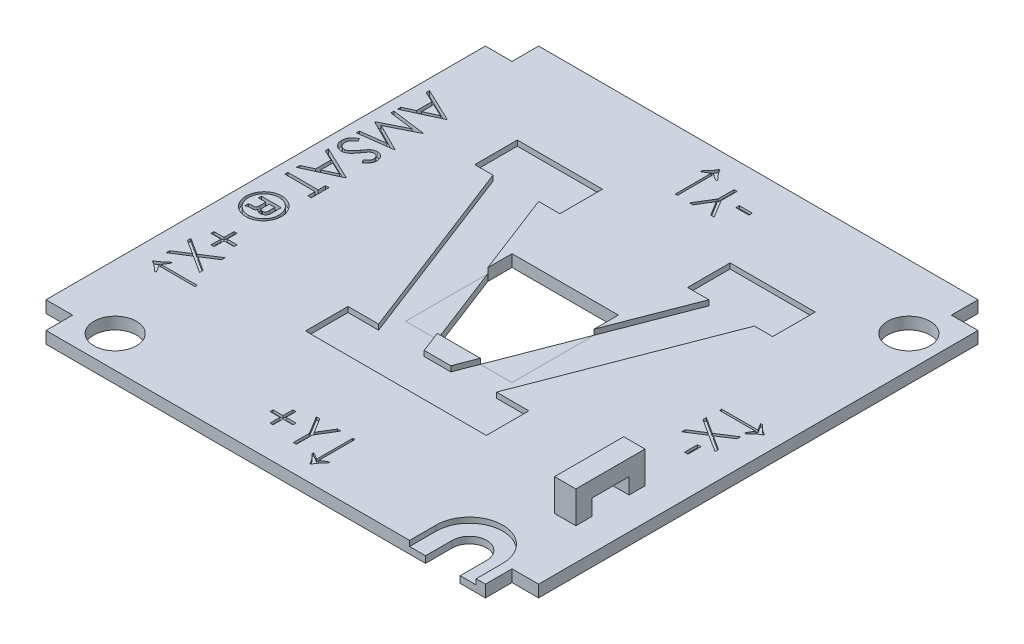
from build123d import *

# Parameters (mm, degrees)
BOSS_EXTRUDE1_DEPTH   = 2.25
SKETCH3_R             = 4
CUT_EXTRUDE1_DEPTH    = 10
CUT_EXTRUDE3_DEPTH    = 10
CUT_EXTRUDE4_DEPTH    = 1
SKETCH7_W             = 20
SKETCH7_H             = 20
CUT_EXTRUDE5_DEPTH    = 10
CUT_EXTRUDE9_DEPTH    = 1
CUT_EXTRUDE10_DEPTH   = 1
CUT_EXTRUDE7_DEPTH    = 1
BOSS_EXTRUDE3_DEPTH   = 2.25
BOSS_EXTRUDE3_2_DEPTH = 2.25
CUT_EXTRUDE8_DEPTH    = 1
SKETCH22_W            = 2.442307692
SKETCH22_H            = 0.651282051
SKETCH22_W_2          = 0.651282051
SKETCH22_H_2          = 2.442307693
CUT_EXTRUDE11_DEPTH   = 0.5
SKETCH23_W            = 4
SKETCH23_H            = 3
BOSS_EXTRUDE4_DEPTH   = 3
SKETCH24_W            = 4
SKETCH24_H            = 13
BOSS_EXTRUDE5_DEPTH   = 3


with BuildPart() as part:
    # Sketch2 → Boss-Extrude1 (new body)
    with BuildSketch(Plane(origin=(0, 0, 0), x_dir=(1, 0, 0), z_dir=(0, 1, 0))):
        Polygon((-41.3, 41.3), (-46.3, 41.3), (-46.3, -41.3), (-41.3, -41.3), (-41.3, -46.3), (41.3, -46.3), (41.3, -41.3), (46.3, -41.3), (46.3, 41.3), (41.3, 41.3), (41.3, 46.3), (-41.3, 46.3), align=None)
    extrude(amount=BOSS_EXTRUDE1_DEPTH)

    # Sketch3 → Cut-Extrude1 (cut)
    with BuildSketch(Plane(origin=(0, 2.25, 0), x_dir=(1, 0, 0), z_dir=(0, 1, 0))):
        with Locations((-34.3, -40.3)):
            Circle(SKETCH3_R)
        with Locations((40.3, 34.3)):
            Circle(SKETCH3_R)
    extrude(amount=-CUT_EXTRUDE1_DEPTH, mode=Mode.SUBTRACT)

    # Sketch5 → Cut-Extrude3 (cut)
    with BuildSketch(Plane(origin=(0, 2.25, 0), x_dir=(1, 0, 0), z_dir=(0, 1, 0))):
        with BuildLine():
            Line((30.05, -41.3), (30.05, -46.3))
            Line((30.05, -46.3), (36.55, -46.3))
            Line((36.55, -46.3), (36.55, -41.3))
            ThreePointArc((36.55, -41.3), (33.3, -38.05), (30.05, -41.3))
        make_face()
    extrude(amount=-CUT_EXTRUDE3_DEPTH, mode=Mode.SUBTRACT)

    # Sketch6 → Cut-Extrude4 (cut)
    with BuildSketch(Plane(origin=(0, 2.25, 0), x_dir=(1, 0, 0), z_dir=(0, 1, 0))):
        with BuildLine():
            Line((27.05, -46.3), (27.05, -41.3))
            ThreePointArc((27.05, -41.3), (33.3, -35.05), (39.55, -41.3))
            Line((39.55, -41.3), (39.55, -46.3))
            Line((39.55, -46.3), (36.55, -46.3))
            Line((36.55, -46.3), (36.55, -41.3))
            Line((36.55, -41.3), (30.05, -41.3))
            Line((30.05, -41.3), (30.05, -46.3))
            Line((30.05, -46.3), (27.05, -46.3))
        make_face()
    extrude(amount=-CUT_EXTRUDE4_DEPTH, mode=Mode.SUBTRACT)

    # Sketch7 → Cut-Extrude5 (cut)
    with BuildSketch(Plane(origin=(0, 2.25, 0), x_dir=(1, 0, 0), z_dir=(0, 1, 0))):
        Rectangle(SKETCH7_W, SKETCH7_H)
    extrude(amount=-CUT_EXTRUDE5_DEPTH, mode=Mode.SUBTRACT)

    # Sketch12 → Cut-Extrude9 (cut)
    # profile 1 of 5: a face of its own
    with BuildSketch(Plane(origin=(0, 2.25, 0), x_dir=(1, 0, 0), z_dir=(0, 1, 0))):
        Polygon((-37.95, 25.69277339), (-44.3, 22.762004159), (-44.3, 23.381485329), (-42.26474359, 24.320247348), (-42.26474359, 27.198863133), (-44.3, 28.164337893), (-44.3, 28.786363133), (-37.95, 25.774183646), align=None)
        Polygon((-39.187690304, 25.739838694), (-41.613461538, 26.889758566), (-41.613461538, 24.620447669), align=None, mode=Mode.SUBTRACT)
    # profile 2 of 5: a face of its own
    with BuildSketch(Plane(origin=(0, 2.25, 0), x_dir=(1, 0, 0), z_dir=(0, 1, 0))):
        Polygon((-44.3, 22.110722108), (-37.95, 21.272450874), (-37.95, 21.191040617), (-43.16025641, 18.569375954), (-37.95, 15.954071467), (-37.95, 15.871389175), (-44.3, 15.0280298), (-44.3, 15.600445666), (-39.730849359, 16.208478518), (-44.3, 18.50068605), (-44.3, 18.629161611), (-39.720673077, 20.93027339), (-44.3, 21.537034207), align=None)
    # profile 3 of 5: a face of its own
    with BuildSketch(Plane(origin=(0, 2.25, 0), x_dir=(1, 0, 0), z_dir=(0, 1, 0))):
        with BuildLine():
            Line((-43.075030048, 14.376747749), (-42.753205128, 13.839948871))
            add(Edge.make_bspline(
                [(-42.753205128, 13.839948871), (-42.836779084, 13.790022926), (-42.996903557, 13.694366742), (-43.213271716, 13.534797848), (-43.397171629, 13.369456709), (-43.547533475, 13.197118918), (-43.665913598, 13.018836412), (-43.749737647, 12.833445344), (-43.802018059, 12.641570458), (-43.808368216, 12.510989382), (-43.811538462, 12.44579823)],
                knots=[0, 0, 0, 0, 1.272034388, 2.437168799, 3.508375237, 4.49857839, 5.41946034, 6.295179144, 7.148887113, 8, 8, 8, 8], degree=3))
            add(Edge.make_bspline(
                [(-43.811538462, 12.44579823), (-43.809987843, 12.390123491), (-43.806913739, 12.279748192), (-43.777375684, 12.117256778), (-43.731996643, 11.959446619), (-43.667006837, 11.809572137), (-43.588379893, 11.66969437), (-43.493403869, 11.547051602), (-43.387093572, 11.440960092), (-43.268404913, 11.354415497), (-43.141200057, 11.287230367), (-43.009462302, 11.238613348), (-42.873771122, 11.20767154), (-42.781776598, 11.203733268), (-42.735396635, 11.201747749)],
                knots=[0, 0, 0, 0, 1.095270387, 2.171376115, 3.241375676, 4.322296363, 5.380636668, 6.392615365, 7.366724986, 8.328592944, 9.273498763, 10.190095884, 11.087518669, 12, 12, 12, 12], degree=3))
            add(Edge.make_bspline(
                [(-42.735396635, 11.201747749), (-42.682526807, 11.20442257), (-42.575050174, 11.20986009), (-42.416482232, 11.255818632), (-42.259559998, 11.328116551), (-42.162493416, 11.394814491), (-42.112099359, 11.42944206)],
                knots=[0, 0, 0, 0, 0.938893495, 1.908633276, 2.914225137, 4, 4, 4, 4], degree=3))
            add(Edge.make_bspline(
                [(-42.112099359, 11.42944206), (-42.075654343, 11.457792544), (-41.998918, 11.517485547), (-41.88660379, 11.621528823), (-41.767920761, 11.740440233), (-41.643350859, 11.874814245), (-41.51516904, 12.027321936), (-41.380703341, 12.194831747), (-41.240357882, 12.378210806), (-41.1475488, 12.50744808), (-41.099559295, 12.574273791)],
                knots=[0, 0, 0, 0, 0.72226686, 1.520759855, 2.393439377, 3.351307446, 4.386958158, 5.510256019, 6.712608938, 8, 8, 8, 8], degree=3))
            add(Edge.make_bspline(
                [(-41.099559295, 12.574273791), (-41.051962251, 12.641074129), (-40.960960328, 12.76879129), (-40.826074223, 12.947538499), (-40.701964103, 13.107163547), (-40.590358776, 13.248479803), (-40.486390583, 13.367831235), (-40.395631639, 13.469580999), (-40.313235518, 13.549975161), (-40.25982663, 13.594712616), (-40.235847356, 13.61479863)],
                knots=[0, 0, 0, 0, 1.452255772, 2.776602448, 3.96446981, 5.032613149, 5.964194703, 6.766668629, 7.446264616, 8, 8, 8, 8], degree=3))
            add(Edge.make_bspline(
                [(-40.235847356, 13.61479863), (-40.198471189, 13.642870248), (-40.124965941, 13.698076852), (-40.010076556, 13.770949462), (-39.892468631, 13.832887657), (-39.771826134, 13.881442174), (-39.649842763, 13.922329314), (-39.524926932, 13.949830131), (-39.397639153, 13.967050237), (-39.311980373, 13.968813698), (-39.269100561, 13.969696467)],
                knots=[0, 0, 0, 0, 1.068054152, 2.10047183, 3.106115577, 4.101338837, 5.06977816, 6.043150881, 7.020423561, 8, 8, 8, 8], degree=3))
            add(Edge.make_bspline(
                [(-39.269100561, 13.969696467), (-39.201912345, 13.967338774), (-39.068972014, 13.962673783), (-38.874869119, 13.922898978), (-38.688987153, 13.860852909), (-38.515420527, 13.771116127), (-38.35457513, 13.660168238), (-38.208908417, 13.529045262), (-38.085408301, 13.373365589), (-37.978755215, 13.201602473), (-37.894548144, 13.014807794), (-37.830689649, 12.819420139), (-37.794988839, 12.614582726), (-37.789808182, 12.4756091), (-37.787179487, 12.405093101)],
                knots=[0, 0, 0, 0, 1.005541892, 1.989591032, 2.955705311, 3.932863626, 4.905387107, 5.876519979, 6.856563935, 7.871847665, 8.897921447, 9.918317993, 10.943742853, 12, 12, 12, 12], degree=3))
            add(Edge.make_bspline(
                [(-37.787179487, 12.405093101), (-37.789712055, 12.330253365), (-37.79473444, 12.181837219), (-37.839966426, 11.963114106), (-37.913030405, 11.752123978), (-37.997182386, 11.582287263), (-38.080853419, 11.44959562), (-38.157094819, 11.348409701), (-38.244859474, 11.245870377), (-38.344390297, 11.141153488), (-38.456597833, 11.036032532), (-38.58071441, 10.928947139), (-38.715981292, 10.819646819), (-38.812545746, 10.749332616), (-38.862049279, 10.71328621)],
                knots=[0, 0, 0, 0, 1.286821612, 2.551921131, 3.825787379, 5.12137259, 5.803616487, 6.523126609, 7.299589446, 8.125436757, 9.008162487, 9.944516264, 10.946261234, 12, 12, 12, 12], degree=3))
            Line((-38.862049279, 10.71328621), (-39.252564103, 11.228460489))
            add(Edge.make_bspline(
                [(-39.252564103, 11.228460489), (-39.212488906, 11.259568109), (-39.135313447, 11.319474112), (-39.027234075, 11.410423329), (-38.928506984, 11.49614586), (-38.842754703, 11.580601638), (-38.76528029, 11.659329911), (-38.698952227, 11.735742826), (-38.643110719, 11.808737593), (-38.583547263, 11.900760248), (-38.524128308, 12.01666691), (-38.474919269, 12.162019776), (-38.444283214, 12.313503716), (-38.440423429, 12.416395831), (-38.438461538, 12.468694864)],
                knots=[0, 0, 0, 0, 1.181667846, 2.275615987, 3.290305621, 4.226321945, 5.078535498, 5.862783384, 6.581873284, 7.217493746, 8.414623899, 9.604724551, 10.782505457, 12, 12, 12, 12], degree=3))
            add(Edge.make_bspline(
                [(-38.438461538, 12.468694864), (-38.440659908, 12.534293126), (-38.444899258, 12.660793195), (-38.491199802, 12.840389766), (-38.564101178, 13.002031602), (-38.666272638, 13.140919827), (-38.787323582, 13.256556914), (-38.926622362, 13.340205389), (-39.080441863, 13.390552116), (-39.187741726, 13.396695795), (-39.242387821, 13.399824672)],
                knots=[0, 0, 0, 0, 1.14458467, 2.207223713, 3.21896685, 4.227309161, 5.202851033, 6.127160689, 7.046193047, 8, 8, 8, 8], degree=3))
            add(Edge.make_bspline(
                [(-39.242387821, 13.399824672), (-39.276399686, 13.399078224), (-39.344479035, 13.397584107), (-39.445325449, 13.378151522), (-39.545276684, 13.350596701), (-39.644777183, 13.310268524), (-39.746167771, 13.25594828), (-39.849174706, 13.182089077), (-39.956398665, 13.089688175), (-40.026067509, 13.018768516), (-40.062850561, 12.981325073)],
                knots=[0, 0, 0, 0, 0.858526328, 1.718456515, 2.587092892, 3.476767204, 4.426280253, 5.487868114, 6.673670035, 8, 8, 8, 8], degree=3))
            add(Edge.make_bspline(
                [(-40.062850561, 12.981325073), (-40.075254879, 12.967425154), (-40.1047247, 12.934402129), (-40.152970695, 12.874030093), (-40.212484296, 12.794305302), (-40.286121284, 12.697309594), (-40.371540509, 12.581254523), (-40.467649776, 12.446127328), (-40.577569109, 12.293434262), (-40.65441779, 12.185081643), (-40.695052083, 12.127789416)],
                knots=[0, 0, 0, 0, 0.420754252, 0.999615792, 1.744751191, 2.668019286, 3.750313428, 4.999500688, 6.413464383, 8, 8, 8, 8], degree=3))
            add(Edge.make_bspline(
                [(-40.695052083, 12.127789416), (-40.745201407, 12.058872116), (-40.842308622, 11.925423316), (-40.988205641, 11.735544564), (-41.130895164, 11.563380084), (-41.269465966, 11.408325414), (-41.402866935, 11.268848738), (-41.53270299, 11.146497444), (-41.658043958, 11.040024853), (-41.818739917, 10.925399699), (-42.016099884, 10.80827337), (-42.257904688, 10.707686635), (-42.500649441, 10.644262204), (-42.663802416, 10.635968169), (-42.744300881, 10.631875954)],
                knots=[0, 0, 0, 0, 1.163667725, 2.253281268, 3.268753668, 4.215851969, 5.092017293, 5.902905408, 6.650798638, 7.335211899, 8.59617414, 9.77448103, 10.901945474, 12, 12, 12, 12], degree=3))
            add(Edge.make_bspline(
                [(-42.744300881, 10.631875954), (-42.801229752, 10.633068853), (-42.913981973, 10.635431485), (-43.079551282, 10.662565226), (-43.240328731, 10.70236958), (-43.394472649, 10.762174417), (-43.544045611, 10.835740017), (-43.687669837, 10.926604091), (-43.823370944, 11.036140674), (-43.953972858, 11.157886149), (-44.071943933, 11.293185837), (-44.177455847, 11.43584641), (-44.265768656, 11.586794036), (-44.336860696, 11.745298111), (-44.393343689, 11.910481824), (-44.433942484, 12.082519011), (-44.458916787, 12.261888745), (-44.461504744, 12.383810693), (-44.462820513, 12.44579823)],
                knots=[0, 0, 0, 0, 0.983610584, 1.948120116, 2.894308362, 3.843560551, 4.801159957, 5.773581695, 6.77566113, 7.813174769, 8.857584665, 9.875476876, 10.877851407, 11.875574773, 12.875048225, 13.892438445, 14.928473903, 16, 16, 16, 16], degree=3))
            add(Edge.make_bspline(
                [(-44.462820513, 12.44579823), (-44.461882457, 12.493757378), (-44.460018158, 12.589071679), (-44.443927019, 12.729674644), (-44.420329169, 12.867695712), (-44.384350994, 13.001401863), (-44.339671815, 13.13245798), (-44.284968625, 13.259695869), (-44.219847258, 13.383424662), (-44.144199851, 13.503788839), (-44.05701888, 13.621922576), (-43.956268568, 13.737220237), (-43.842644818, 13.851000836), (-43.71498239, 13.9611786), (-43.574645227, 14.069784393), (-43.420457442, 14.174798493), (-43.253219433, 14.278359297), (-43.135535911, 14.343339035), (-43.075030048, 14.376747749)],
                knots=[0, 0, 0, 0, 0.915384692, 1.819241058, 2.699029451, 3.586605375, 4.459625921, 5.340865773, 6.228072412, 7.126546901, 8.052715223, 9.028303326, 10.047266019, 11.120332924, 12.245748783, 13.433636234, 14.680528497, 16, 16, 16, 16], degree=3))
        make_face()
    # profile 4 of 5: a face of its own
    with BuildSketch(Plane(origin=(0, 2.25, 0), x_dir=(1, 0, 0), z_dir=(0, 1, 0))):
        Polygon((-37.95, 6.724183646), (-44.3, 3.793414416), (-44.3, 4.412895585), (-42.26474359, 5.351657605), (-42.26474359, 8.23027339), (-44.3, 9.195748149), (-44.3, 9.81777339), (-37.95, 6.805593903), align=None)
        Polygon((-39.187690304, 6.771248951), (-41.613461538, 7.921168823), (-41.613461538, 5.651857925), align=None, mode=Mode.SUBTRACT)
    # profile 5 of 5: a face of its own
    with BuildSketch(Plane(origin=(0, 2.25, 0), x_dir=(1, 0, 0), z_dir=(0, 1, 0))):
        Polygon((-38.601282051, 3.549183646), (-37.95, 3.549183646), (-37.95, 0.211363133), (-38.601282051, 0.211363133), (-38.601282051, 1.595337492), (-44.3, 1.595337492), (-44.3, 2.165209287), (-38.601282051, 2.165209287), align=None)
    extrude(amount=-CUT_EXTRUDE9_DEPTH, mode=Mode.SUBTRACT)

    # Sketch21 → Cut-Extrude10 (cut)
    # profile 1 of 2: a face of its own
    with BuildSketch(Plane(origin=(0, 2.25, 0), x_dir=(1, 0, 0), z_dir=(0, 1, 0))):
        with BuildLine():
            add(Edge.make_bspline(
                [(-41.037229567, -8.996703827), (-41.185025561, -8.994941244), (-41.405937841, -8.983966074), (-41.695013938, -8.935440543), (-41.906637632, -8.885818691), (-42.114142537, -8.822359309), (-42.317418418, -8.74391298), (-42.517002942, -8.652773965), (-42.711344658, -8.546897571), (-42.898657192, -8.429725798), (-43.076064204, -8.300134551), (-43.244757317, -8.161773217), (-43.402327399, -8.011171929), (-43.550390858, -7.850710696), (-43.687693075, -7.679324729), (-43.817196462, -7.498993653), (-43.932709462, -7.307124199), (-44.038585529, -7.109692408), (-44.129806593, -6.907216656), (-44.208743963, -6.701669085), (-44.269954104, -6.491515382), (-44.320134867, -6.278937571), (-44.368634279, -5.989414625), (-44.379667073, -5.768526321), (-44.381410256, -5.620722256)],
                knots=[0, 0, 0, 0, 0.084081566, 0.125371117, 0.166471693, 0.207566613, 0.248614148, 0.290245601, 0.332200249, 0.37433108, 0.415744967, 0.457006367, 0.498264248, 0.539544652, 0.58102722, 0.623028231, 0.665647139, 0.708238775, 0.750308889, 0.79180686, 0.833293628, 0.874628883, 0.915918434, 1, 1, 1, 1], degree=3))
            add(Edge.make_bspline(
                [(-37.705769231, -5.620722256), (-37.704080099, -5.769216124), (-37.720136076, -5.990400947), (-37.765552914, -6.281016807), (-37.814108136, -6.493908612), (-37.876550896, -6.702986469), (-37.953096143, -6.908211958), (-38.04364369, -7.109602805), (-38.147621504, -7.305714146), (-38.263229735, -7.495423023), (-38.390020448, -7.67581506), (-38.52805122, -7.845528591), (-38.676278958, -8.005378133), (-38.83530041, -8.155260381), (-39.004418338, -8.295644859), (-39.185218114, -8.424372289), (-39.374446991, -8.543285117), (-39.570959833, -8.649469881), (-39.770684486, -8.74296099), (-39.973983084, -8.820853083), (-40.180703646, -8.884204487), (-40.390291897, -8.935701592), (-40.675362882, -8.983455777), (-40.892346195, -8.995263606), (-41.037229567, -8.996703827)],
                knots=[0, 0, 0, 0, 0.084514054, 0.126089622, 0.167456995, 0.208798976, 0.250298702, 0.292137242, 0.334491317, 0.376661106, 0.418610353, 0.459991826, 0.501181122, 0.542700524, 0.584388198, 0.626280387, 0.669036822, 0.711618933, 0.753438644, 0.794571956, 0.835521899, 0.8765295, 0.917428837, 1, 1, 1, 1], degree=3))
            add(Edge.make_bspline(
                [(-41.053766026, -2.239652545), (-40.907207032, -2.241168371), (-40.687647811, -2.252754617), (-40.400175455, -2.300715851), (-40.189081764, -2.350777818), (-39.981001675, -2.414170416), (-39.777030342, -2.493450355), (-39.575642941, -2.585186008), (-39.379988073, -2.692135268), (-39.189917948, -2.809224367), (-39.00950782, -2.938201824), (-38.840808271, -3.078568793), (-38.680567629, -3.227602011), (-38.531924227, -3.387986101), (-38.393761786, -3.559264749), (-38.267279345, -3.741352191), (-38.149773733, -3.931463838), (-38.046929911, -4.129433814), (-37.953701498, -4.330632119), (-37.878118854, -4.536896779), (-37.815509182, -4.74680099), (-37.765322579, -4.959857613), (-37.720345405, -5.251089431), (-37.703973566, -5.472205046), (-37.705769231, -5.620722256)],
                knots=[0, 0, 0, 0, 0.083231423, 0.124456947, 0.165259547, 0.206290743, 0.247810239, 0.289377135, 0.331804555, 0.374278361, 0.416018365, 0.457554597, 0.49875834, 0.54013811, 0.581556351, 0.623550197, 0.665897685, 0.70831077, 0.750096537, 0.791671096, 0.832862889, 0.874368434, 0.915792968, 1, 1, 1, 1], degree=3))
            add(Edge.make_bspline(
                [(-44.381410256, -5.620722256), (-44.379558287, -5.472956417), (-44.368828326, -5.25153536), (-44.319678737, -4.961888521), (-44.272405297, -4.748514834), (-44.207316139, -4.539689589), (-44.132027545, -4.332863627), (-44.03935247, -4.13094126), (-43.93567913, -3.932587601), (-43.819366368, -3.74172946), (-43.691825576, -3.559971457), (-43.552723157, -3.3899736), (-43.405043319, -3.228834319), (-43.246808709, -3.078563402), (-43.078938004, -2.938237631), (-42.90003963, -2.809572349), (-42.712317739, -2.692159042), (-42.518935428, -2.584860969), (-42.319349063, -2.493807998), (-42.117329026, -2.413893003), (-41.910812948, -2.350810215), (-41.70140652, -2.300865281), (-41.416534612, -2.252597153), (-41.199038731, -2.24131999), (-41.053766026, -2.239652545)],
                knots=[0, 0, 0, 0, 0.084268799, 0.125888631, 0.167261664, 0.208679102, 0.250410951, 0.292574748, 0.335148295, 0.377862107, 0.419817093, 0.461544047, 0.502916375, 0.544266128, 0.585773641, 0.627475415, 0.669700064, 0.71186386, 0.753368561, 0.794594645, 0.83555019, 0.876272109, 0.917177041, 1, 1, 1, 1], degree=3))
        make_face()
        with BuildLine():
            add(Edge.make_bspline(
                [(-41.043589744, -8.508242288), (-40.919097987, -8.507277755), (-40.73282162, -8.496925282), (-40.489082322, -8.455506635), (-40.309676413, -8.413415455), (-40.133125907, -8.35900123), (-39.959689197, -8.290876691), (-39.788998792, -8.211767148), (-39.621458047, -8.122268639), (-39.460525748, -8.020263971), (-39.306978255, -7.910113274), (-39.161795272, -7.791421575), (-39.027695093, -7.662034984), (-38.899423308, -7.526722239), (-38.783119321, -7.380354006), (-38.672201724, -7.228057059), (-38.574551414, -7.065430397), (-38.485105671, -6.898011257), (-38.407856586, -6.726151873), (-38.340805407, -6.551513325), (-38.287803062, -6.372715819), (-38.245371071, -6.191018024), (-38.20668801, -5.943087253), (-38.194454079, -5.754643231), (-38.194230769, -5.628354468)],
                knots=[0, 0, 0, 0, 0.083086621, 0.124098934, 0.164782219, 0.205935711, 0.247220212, 0.28898156, 0.331375079, 0.373828943, 0.415981172, 0.457375012, 0.498787209, 0.540210995, 0.581645401, 0.623402918, 0.665799268, 0.708059538, 0.749960496, 0.791407451, 0.832749076, 0.874258715, 0.915783768, 1, 1, 1, 1], degree=3))
            add(Edge.make_bspline(
                [(-43.892948718, -5.628354468), (-43.892854073, -5.754261112), (-43.880061897, -5.942149919), (-43.842396224, -6.189558621), (-43.797520788, -6.370365078), (-43.744973365, -6.549322012), (-43.6783207, -6.724568446), (-43.600543765, -6.897235248), (-43.510673921, -7.06541623), (-43.409904176, -7.22745761), (-43.302785864, -7.383608001), (-43.183612027, -7.528291771), (-43.057134321, -7.664689727), (-42.924141991, -7.793986775), (-42.780287345, -7.912126939), (-42.629513835, -8.023463495), (-42.469308933, -8.122841507), (-42.30409144, -8.213738214), (-42.134384757, -8.292065045), (-41.96108282, -8.358942757), (-41.784776744, -8.413652447), (-41.604039255, -8.455630499), (-41.357708094, -8.49674846), (-41.169377704, -8.507600864), (-41.043589744, -8.508242288)],
                knots=[0, 0, 0, 0, 0.083922308, 0.125441802, 0.166735303, 0.208071393, 0.24977732, 0.291672667, 0.334309784, 0.376848307, 0.418898952, 0.460506, 0.501731656, 0.542934025, 0.584104354, 0.625793017, 0.667851269, 0.709741844, 0.751497601, 0.792410697, 0.833558679, 0.87451183, 0.916076567, 1, 1, 1, 1], degree=3))
            add(Edge.make_bspline(
                [(-41.05249399, -2.728114083), (-41.17740134, -2.729052496), (-41.364132062, -2.739314103), (-41.608249757, -2.780918013), (-41.787373189, -2.822593603), (-41.962980018, -2.878017617), (-42.136408973, -2.943543034), (-42.305760537, -3.023491302), (-42.472137213, -3.112759587), (-42.631183376, -3.214618105), (-42.783847152, -3.324269685), (-42.927323843, -3.443471448), (-43.0617338, -3.573034824), (-43.187163043, -3.711437773), (-43.305031351, -3.858704674), (-43.414442347, -4.014677775), (-43.513158247, -4.180002635), (-43.60136719, -4.350604278), (-43.679739236, -4.524464955), (-43.746075968, -4.701087006), (-43.799444533, -4.881436754), (-43.841641057, -5.064033736), (-43.880662333, -5.312747856), (-43.892562982, -5.501662582), (-43.892948718, -5.628354468)],
                knots=[0, 0, 0, 0, 0.083160864, 0.124070639, 0.164652209, 0.205433361, 0.246513038, 0.287914089, 0.329953356, 0.372062625, 0.413486741, 0.45495695, 0.49606181, 0.537605853, 0.579156602, 0.621500564, 0.664273779, 0.707177994, 0.74923146, 0.791102819, 0.8326114, 0.874292216, 0.91571345, 1, 1, 1, 1], degree=3))
            add(Edge.make_bspline(
                [(-38.194230769, -5.628354468), (-38.194419414, -5.50121242), (-38.206758121, -5.311526117), (-38.245204318, -5.062269886), (-38.287978548, -4.879799857), (-38.341011407, -4.699779187), (-38.40782083, -4.522942971), (-38.485090619, -4.34855313), (-38.574532608, -4.178588456), (-38.67217358, -4.01343352), (-38.783131744, -3.858606905), (-38.899072787, -3.709836471), (-39.027258608, -3.573031631), (-39.162317052, -3.443874346), (-39.306108346, -3.323416915), (-39.461023438, -3.21508512), (-39.621365212, -3.112669485), (-39.789078957, -3.023501869), (-39.959685487, -2.943522244), (-40.134393987, -2.878038803), (-40.311638573, -2.822371966), (-40.492548533, -2.781097789), (-40.738729918, -2.73923946), (-40.926749158, -2.729090894), (-41.05249399, -2.728114083)],
                knots=[0, 0, 0, 0, 0.084265662, 0.125816231, 0.167073799, 0.208433723, 0.250155126, 0.292314647, 0.334815834, 0.377435864, 0.419398092, 0.461019926, 0.502397999, 0.543558718, 0.584880408, 0.626613175, 0.668809235, 0.710945317, 0.752453067, 0.793648332, 0.834551917, 0.875535607, 0.916576146, 1, 1, 1, 1], degree=3))
        make_face(mode=Mode.SUBTRACT)
    # profile 2 of 2: a face of its own
    with BuildSketch(Plane(origin=(0, 2.25, 0), x_dir=(1, 0, 0), z_dir=(0, 1, 0))):
        with BuildLine():
            Line((-39.171153846, -5.775910558), (-39.171153846, -4.193498699))
            Line((-39.171153846, -4.193498699), (-42.916025641, -4.193498699))
            Line((-42.916025641, -4.193498699), (-42.916025641, -4.763370493))
            Line((-42.916025641, -4.763370493), (-41.532051282, -4.763370493))
            Line((-41.532051282, -4.763370493), (-41.532051282, -5.769550381))
            add(Edge.make_bspline(
                [(-42.020512821, -6.554396134), (-41.956735264, -6.547416281), (-41.866530544, -6.53837851), (-41.762015173, -6.502174133), (-41.704701262, -6.470544689), (-41.660882537, -6.430542544), (-41.622858556, -6.385835164), (-41.593821974, -6.332321022), (-41.569297824, -6.268458782), (-41.551651269, -6.184563049), (-41.534544688, -6.016425353), (-41.5322698, -5.874308872), (-41.532051282, -5.769550381)],
                knots=[0, 0, 0, 0, 0.179641353, 0.249903677, 0.30706132, 0.360638264, 0.414345343, 0.469892587, 0.529360675, 0.604463637, 0.707938712, 1, 1, 1, 1], degree=3))
            Line((-42.020512821, -6.554396134), (-42.427564103, -6.574748699))
            add(Edge.make_bspline(
                [(-42.916025641, -6.635806391), (-42.841651587, -6.619567658), (-42.679132453, -6.5953224), (-42.515616278, -6.579518291), (-42.427564103, -6.574748699)],
                knots=[0, 0, 0, 0, 0.463213932, 1, 1, 1, 1], degree=3))
            Line((-42.916025641, -6.635806391), (-42.916025641, -7.368498699))
            Line((-42.916025641, -7.368498699), (-42.816806891, -7.290904548))
            add(Edge.make_bspline(
                [(-42.319441106, -7.124267929), (-42.411999803, -7.12304751), (-42.591490743, -7.148949358), (-42.751007609, -7.235410471), (-42.816806891, -7.290904548)],
                knots=[0, 0, 0, 0, 0.51899268, 1, 1, 1, 1], degree=3))
            Line((-42.319441106, -7.124267929), (-41.897125401, -7.124267929))
            add(Edge.make_bspline(
                [(-41.047405849, -6.68159966), (-41.083160139, -6.759708663), (-41.146524087, -6.864558162), (-41.251200503, -6.978618556), (-41.336174878, -7.038693297), (-41.439490244, -7.078732939), (-41.626895792, -7.117609293), (-41.783645007, -7.125378877), (-41.897125401, -7.124267929)],
                knots=[0, 0, 0, 0, 0.248758357, 0.352184632, 0.446606134, 0.547460389, 0.670874122, 1, 1, 1, 1], degree=3))
            add(Edge.make_bspline(
                [(-40.711588542, -7.055578025), (-40.773822444, -7.020632686), (-40.895574793, -6.901742722), (-40.99585164, -6.765502952), (-41.047405849, -6.68159966)],
                knots=[0, 0, 0, 0, 0.418043723, 1, 1, 1, 1], degree=3))
            add(Edge.make_bspline(
                [(-40.219310897, -7.124267929), (-40.308426256, -7.126678042), (-40.474277794, -7.111710243), (-40.638356585, -7.081954397), (-40.711588542, -7.055578025)],
                knots=[0, 0, 0, 0, 0.534351952, 1, 1, 1, 1], degree=3))
            add(Edge.make_bspline(
                [(-39.171153846, -5.775910558), (-39.170760669, -5.862020148), (-39.173324387, -5.986445447), (-39.185177255, -6.145477365), (-39.198297791, -6.250191982), (-39.212865728, -6.34545132), (-39.23162335, -6.430990644), (-39.254848411, -6.506442235), (-39.287832052, -6.594377099), (-39.342753381, -6.69210624), (-39.423921502, -6.798194891), (-39.523077409, -6.892806805), (-39.63829461, -6.975440172), (-39.768178268, -7.040693844), (-39.959503574, -7.108838942), (-40.114964471, -7.122077707), (-40.219310897, -7.124267929)],
                knots=[0, 0, 0, 0, 0.131785794, 0.19036453, 0.243969783, 0.293257433, 0.337811016, 0.377839134, 0.413992496, 0.48137038, 0.548472713, 0.617773073, 0.69034139, 0.764635786, 0.839542622, 1, 1, 1, 1], degree=3))
        make_face()
        with BuildLine():
            Line((-40.880769231, -4.763370493), (-39.822435897, -4.763370493))
            Line((-39.822435897, -4.763370493), (-39.822435897, -5.767006311))
            add(Edge.make_bspline(
                [(-40.347786458, -6.554396134), (-40.267890457, -6.555812265), (-40.15144409, -6.537957401), (-40.019637927, -6.465724347), (-39.956921203, -6.403551523), (-39.918541001, -6.341781915), (-39.891127631, -6.286863659), (-39.870786232, -6.221815288), (-39.852543947, -6.148386548), (-39.839187282, -6.065827577), (-39.824561861, -5.93790657), (-39.824296556, -5.836918467), (-39.822435897, -5.767006311)],
                knots=[0, 0, 0, 0, 0.220304065, 0.315334337, 0.409335901, 0.459152797, 0.514956494, 0.577645899, 0.646090602, 0.72296648, 0.807444192, 1, 1, 1, 1], degree=3))
            add(Edge.make_bspline(
                [(-40.790454728, -6.324157753), (-40.75083476, -6.398043078), (-40.618458429, -6.524669711), (-40.438385554, -6.555843294), (-40.347786458, -6.554396134)],
                knots=[0, 0, 0, 0, 0.477172649, 1, 1, 1, 1], degree=3))
            add(Edge.make_bspline(
                [(-40.880769231, -5.728845253), (-40.882536105, -5.851961801), (-40.871970561, -6.05403589), (-40.829315055, -6.253651256), (-40.790454728, -6.324157753)],
                knots=[0, 0, 0, 0, 0.607223379, 1, 1, 1, 1], degree=3))
            Line((-40.880769231, -5.728845253), (-40.880769231, -4.763370493))
        make_face(mode=Mode.SUBTRACT)
    extrude(amount=-CUT_EXTRUDE10_DEPTH, mode=Mode.SUBTRACT)

    # Sketch18 → Cut-Extrude7 (cut)
    with BuildSketch(Plane(origin=(0, 2.25, 0), x_dir=(1, 0, 0), z_dir=(0, 1, 0))):
        Polygon((-2.5, -14), (-16, 21), (-12, 21), (-12, 29), (-28, 29), (-28, 21), (-24.574475649, 21), (-11.074475649, -14), (-16.824113427, -14), (-16.824113427, -22), (17.175886573, -22), (17.175886573, -14), (11.074475649, -14), (24.574475649, 21), (28, 21), (28, 29), (12, 29), (12, 21), (16, 21), (2.5, -14), align=None)
    extrude(amount=-CUT_EXTRUDE7_DEPTH, mode=Mode.SUBTRACT)

    # Sketch22 → Cut-Extrude11 (cut)
    with BuildSketch(Plane(origin=(0, 2.25, 0), x_dir=(1, 0, 0), z_dir=(0, 1, 0))):
        with BuildLine():
            add(Edge.make_bspline(
                [(-40.782652244, -26.458333333), (-40.865603402, -26.370426452), (-41.026344825, -26.200081909), (-41.269084536, -25.962036452), (-41.504740707, -25.749162433), (-41.731366375, -25.560413849), (-41.951114728, -25.397961489), (-42.162058928, -25.259808749), (-42.365726879, -25.14589947), (-42.502769753, -25.087258893), (-42.568589744, -25.059094551)],
                knots=[0, 0, 0, 0, 1.268919897, 2.458892609, 3.568401112, 4.602379556, 5.554201575, 6.435838317, 7.248752563, 8, 8, 8, 8], degree=3))
            Line((-42.568589744, -25.059094551), (-42.568589744, -24.873377404))
            add(Edge.make_bspline(
                [(-42.568589744, -24.873377404), (-42.498486652, -24.840545112), (-42.353661673, -24.772717348), (-42.141364869, -24.646553355), (-41.923706079, -24.500808242), (-41.702881295, -24.332466122), (-41.477687257, -24.142022631), (-41.24759275, -23.931215182), (-41.014525691, -23.697474643), (-40.861381426, -23.531486087), (-40.782652244, -23.446153846)],
                knots=[0, 0, 0, 0, 0.806674609, 1.666497584, 2.571372681, 3.536893284, 4.559717442, 5.645448402, 6.789560146, 8, 8, 8, 8], degree=3))
            Line((-40.782652244, -23.446153846), (-40.451923077, -23.446153846))
            add(Edge.make_bspline(
                [(-40.451923077, -23.446153846), (-40.484471117, -23.516795518), (-40.547891839, -23.654442695), (-40.64935602, -23.851429389), (-40.748436612, -24.036189719), (-40.851377879, -24.205419382), (-40.951733434, -24.362468561), (-41.055968393, -24.503574004), (-41.157829341, -24.63327658), (-41.230706152, -24.711033387), (-41.266025641, -24.748717949)],
                knots=[0, 0, 0, 0, 1.209567812, 2.356875072, 3.445837619, 4.469393631, 5.437034397, 6.343238918, 7.197056603, 8, 8, 8, 8], degree=3))
            Line((-41.266025641, -24.748717949), (-34.427564103, -24.748717949))
            Line((-34.427564103, -24.748717949), (-34.427564103, -25.155769231))
            Line((-34.427564103, -25.155769231), (-41.266025641, -25.155769231))
            add(Edge.make_bspline(
                [(-41.266025641, -25.155769231), (-41.188467457, -25.25535281), (-41.032774842, -25.455259862), (-40.820341975, -25.773532571), (-40.625188841, -26.108048438), (-40.509949054, -26.341024392), (-40.451923077, -26.458333333)],
                knots=[0, 0, 0, 0, 0.983597024, 1.974502037, 2.98011354, 4, 4, 4, 4], degree=3))
            Line((-40.451923077, -26.458333333), (-40.782652244, -26.458333333))
        make_face()
        Polygon((-42.65, -22.347115385), (-42.65, -21.689473157), (-40.052504006, -20.026923077), (-42.65, -18.364372997), (-42.65, -17.706730769), (-39.538601763, -19.697465946), (-36.3, -17.625320513), (-36.3, -18.28296274), (-39.024699519, -20.026923077), (-36.3, -21.770883413), (-36.3, -22.428525641), (-39.538601763, -20.355108173), align=None)
        Polygon((-39.719230769, -14.979487179), (-41.591666667, -14.979487179), (-41.591666667, -14.409615385), (-39.719230769, -14.409615385), (-39.719230769, -12.537179487), (-39.149358974, -12.537179487), (-39.149358974, -14.409615385), (-37.276923077, -14.409615385), (-37.276923077, -14.979487179), (-39.149358974, -14.979487179), (-39.149358974, -16.851923077), (-39.719230769, -16.851923077), align=None)
        Polygon((-5.169551282, -37.880769231), (-5.169551282, -36.008333333), (-4.599679487, -36.008333333), (-4.599679487, -37.880769231), (-2.72724359, -37.880769231), (-2.72724359, -38.450641026), (-4.599679487, -38.450641026), (-4.599679487, -40.323076923), (-5.169551282, -40.323076923), (-5.169551282, -38.450641026), (-7.041987179, -38.450641026), (-7.041987179, -37.880769231), align=None)
        Polygon((-1.831730769, -34.95), (-1.179176683, -34.95), (0.489733574, -37.678515625), (2.15609976, -34.95), (2.808653846, -34.95), (0.773397436, -38.281460337), (0.773397436, -41.3), (0.203525641, -41.3), (0.203525641, -38.281460337), align=None)
        with BuildLine():
            Line((3.785576923, -41.382682292), (3.785576923, -41.055769231))
            add(Edge.make_bspline(
                [(3.785576923, -41.055769231), (3.902885864, -41.113795208), (4.135861818, -41.229034995), (4.470377685, -41.424188129), (4.788650394, -41.636620996), (4.988557446, -41.792313611), (5.088141026, -41.869871795)],
                knots=[0, 0, 0, 0, 1.01988646, 2.025497963, 3.016402976, 4, 4, 4, 4], degree=3))
            Line((5.088141026, -41.869871795), (5.088141026, -35.031410256))
            Line((5.088141026, -35.031410256), (5.495192308, -35.031410256))
            Line((5.495192308, -35.031410256), (5.495192308, -41.869871795))
            add(Edge.make_bspline(
                [(5.495192308, -41.869871795), (5.532946049, -41.834639391), (5.611040322, -41.761760547), (5.739824712, -41.658312909), (5.881947698, -41.554644879), (6.037658745, -41.452202884), (6.208246022, -41.351466696), (6.39205387, -41.251539961), (6.589850036, -41.152061485), (6.727185497, -41.088454291), (6.79775641, -41.055769231)],
                knots=[0, 0, 0, 0, 0.802803951, 1.660614015, 2.566661157, 3.537744655, 4.557739901, 5.646513329, 6.790642251, 8, 8, 8, 8], degree=3))
            Line((6.79775641, -41.055769231), (6.79775641, -41.386498397))
            add(Edge.make_bspline(
                [(6.79775641, -41.386498397), (6.712346304, -41.465150014), (6.545985409, -41.618346795), (6.313116739, -41.852707015), (6.101829136, -42.082749269), (5.91147491, -42.308022868), (5.743038424, -42.528785793), (5.597766748, -42.746299651), (5.470855007, -42.95773292), (5.403305494, -43.102298013), (5.370532853, -43.172435897)],
                knots=[0, 0, 0, 0, 1.210543577, 2.357883875, 3.443707871, 4.466619676, 5.432223013, 6.337175649, 7.193256267, 8, 8, 8, 8], degree=3))
            Line((5.370532853, -43.172435897), (5.184815705, -43.172435897))
            add(Edge.make_bspline(
                [(5.184815705, -43.172435897), (5.156598582, -43.10706487), (5.097682182, -42.970572371), (4.984188987, -42.767124105), (4.84554439, -42.556103181), (4.683950226, -42.335304612), (4.494707833, -42.108609332), (4.281556754, -41.872816781), (4.043542361, -41.62881944), (3.873447468, -41.466523777), (3.785576923, -41.382682292)],
                knots=[0, 0, 0, 0, 0.746358587, 1.558371544, 2.439030802, 3.39337854, 4.426210597, 5.534488972, 6.726323911, 8, 8, 8, 8], degree=3))
        make_face()
        with BuildLine():
            Line((-5.658012821, 41.382682292), (-5.658012821, 41.055769231))
            add(Edge.make_bspline(
                [(-5.658012821, 41.055769231), (-5.540652772, 41.113710154), (-5.307903897, 41.228618804), (-4.974130695, 41.424976771), (-4.65506258, 41.636166662), (-4.454980858, 41.792234626), (-4.355448718, 41.869871795)],
                knots=[0, 0, 0, 0, 1.019914214, 2.022697593, 3.01637621, 4, 4, 4, 4], degree=3))
            Line((-4.355448718, 41.869871795), (-4.355448718, 35.031410256))
            Line((-4.355448718, 35.031410256), (-3.948397436, 35.031410256))
            Line((-3.948397436, 35.031410256), (-3.948397436, 41.869871795))
            add(Edge.make_bspline(
                [(-3.948397436, 41.869871795), (-3.910648128, 41.834632496), (-3.832563024, 41.761739391), (-3.703704855, 41.658406496), (-3.562075903, 41.554398824), (-3.405129702, 41.453906084), (-3.235820568, 41.351102382), (-3.051453417, 41.251675108), (-2.853762149, 41.152024705), (-2.716411864, 41.088441806), (-2.645833333, 41.055769231)],
                knots=[0, 0, 0, 0, 0.802826809, 1.660661296, 2.566734236, 3.5342345, 4.557641891, 5.64644632, 6.790607818, 8, 8, 8, 8], degree=3))
            Line((-2.645833333, 41.055769231), (-2.645833333, 41.386498397))
            add(Edge.make_bspline(
                [(-2.645833333, 41.386498397), (-2.73124344, 41.465150014), (-2.897604334, 41.618346795), (-3.130473004, 41.852707015), (-3.341760607, 42.082749269), (-3.532114833, 42.308022868), (-3.70055132, 42.528785793), (-3.845822996, 42.746299651), (-3.972734737, 42.95773292), (-4.04028425, 43.102298013), (-4.073056891, 43.172435897)],
                knots=[0, 0, 0, 0, 1.210543577, 2.357883875, 3.443707871, 4.466619676, 5.432223013, 6.337175649, 7.193256267, 8, 8, 8, 8], degree=3))
            Line((-4.073056891, 43.172435897), (-4.258774038, 43.172435897))
            add(Edge.make_bspline(
                [(-4.258774038, 43.172435897), (-4.286985651, 43.107060721), (-4.345890545, 42.970559558), (-4.459478533, 42.767182669), (-4.597853404, 42.55564428), (-4.761175106, 42.336168075), (-4.948658013, 42.108084312), (-5.162153364, 41.872913424), (-5.400013895, 41.628792554), (-5.570130869, 41.466514619), (-5.658012821, 41.382682292)],
                knots=[0, 0, 0, 0, 0.746376284, 1.558408495, 2.439088635, 3.396097288, 4.426125859, 5.534430513, 6.726293711, 8, 8, 8, 8], degree=3))
        make_face()
        Polygon((-1.5875, 34.95), (-0.934945913, 34.95), (0.733964343, 37.678515625), (2.400330529, 34.95), (3.052884615, 34.95), (1.017628205, 38.281460337), (1.017628205, 41.3), (0.44775641, 41.3), (0.44775641, 38.281460337), align=None)
        with Locations((4.7625, 38.857692308)):
            Rectangle(SKETCH22_W, SKETCH22_H)
        with BuildLine():
            Line((41.382682292, 5.698717949), (41.055769231, 5.698717949))
            add(Edge.make_bspline(
                [(41.055769231, 5.698717949), (41.113795208, 5.581409008), (41.229034995, 5.348433054), (41.424188129, 5.013917186), (41.636620996, 4.695644477), (41.792313611, 4.495737426), (41.869871795, 4.396153846)],
                knots=[0, 0, 0, 0, 1.01988646, 2.025497963, 3.016402976, 4, 4, 4, 4], degree=3))
            Line((41.869871795, 4.396153846), (35.031410256, 4.396153846))
            Line((35.031410256, 4.396153846), (35.031410256, 3.989102564))
            Line((35.031410256, 3.989102564), (41.869871795, 3.989102564))
            add(Edge.make_bspline(
                [(41.869871795, 3.989102564), (41.834632496, 3.951353256), (41.761739391, 3.873268153), (41.658406496, 3.744409983), (41.554398824, 3.602781031), (41.453906084, 3.44583483), (41.351102382, 3.276525696), (41.251675108, 3.092158545), (41.152024705, 2.894467277), (41.088441806, 2.757116992), (41.055769231, 2.686538462)],
                knots=[0, 0, 0, 0, 0.802826809, 1.660661296, 2.566734236, 3.5342345, 4.557641891, 5.64644632, 6.790607818, 8, 8, 8, 8], degree=3))
            Line((41.055769231, 2.686538462), (41.386498397, 2.686538462))
            add(Edge.make_bspline(
                [(41.386498397, 2.686538462), (41.465150014, 2.771948568), (41.618346795, 2.938309463), (41.852707015, 3.171178133), (42.082749269, 3.382465736), (42.308022868, 3.572819962), (42.528785793, 3.741256448), (42.746299651, 3.886528124), (42.95773292, 4.013439865), (43.102298013, 4.080989378), (43.172435897, 4.113762019)],
                knots=[0, 0, 0, 0, 1.210543577, 2.357883875, 3.443707871, 4.466619676, 5.432223013, 6.337175649, 7.193256267, 8, 8, 8, 8], degree=3))
            Line((43.172435897, 4.113762019), (43.172435897, 4.299479167))
            add(Edge.make_bspline(
                [(43.172435897, 4.299479167), (43.10706487, 4.32769629), (42.970572371, 4.38661269), (42.767124105, 4.500105885), (42.556103181, 4.638750482), (42.335304612, 4.800344646), (42.108609332, 4.989587039), (41.872816781, 5.202738118), (41.62881944, 5.440752511), (41.466523777, 5.610847404), (41.382682292, 5.698717949)],
                knots=[0, 0, 0, 0, 0.746358587, 1.558371544, 2.439030802, 3.39337854, 4.426210597, 5.534488972, 6.726323911, 8, 8, 8, 8], degree=3))
        make_face()
        Polygon((34.95, 1.5875), (34.95, 0.929857772), (37.547495994, -0.732692308), (34.95, -2.395242388), (34.95, -3.052884615), (38.061398237, -1.062149439), (41.3, -3.134294872), (41.3, -2.476652644), (38.575300481, -0.732692308), (41.3, 1.011268029), (41.3, 1.668910256), (38.061398237, -0.404507212), align=None)
        with Locations((38.857692308, -4.884615384)):
            Rectangle(SKETCH22_W_2, SKETCH22_H_2)
    extrude(amount=-CUT_EXTRUDE11_DEPTH, mode=Mode.SUBTRACT)

    # Sketch23 → Boss-Extrude4 (add)
    with BuildSketch(Plane(origin=(0, 2.25, 0), x_dir=(1, 0, 0), z_dir=(0, 1, 0))):
        with Locations((38.3, -16.8)):
            Rectangle(SKETCH23_W, SKETCH23_H)
        with Locations((38.3, -26.8)):
            Rectangle(SKETCH23_W, SKETCH23_H)
    extrude(amount=BOSS_EXTRUDE4_DEPTH)

    # Sketch24 → Boss-Extrude5 (add)
    with BuildSketch(Plane(origin=(0, 5.25, 0), x_dir=(1, 0, 0), z_dir=(0, 1, 0))):
        with Locations((38.3, -21.8)):
            Rectangle(SKETCH24_W, SKETCH24_H)
    extrude(amount=BOSS_EXTRUDE5_DEPTH)


with BuildPart() as body_2:
    # Sketch19 → Boss-Extrude3 (new body)
    with BuildSketch(Plane(origin=(0, 2.25, 0), x_dir=(1, 0, 0), z_dir=(0, 1, 0))):
        Polygon((10, 5.444444444), (4.042857143, -10), (10, -10), align=None)
    extrude(amount=-BOSS_EXTRUDE3_DEPTH)


with BuildPart() as body_3:
    # Sketch19 → Boss-Extrude3 2 (new body)
    with BuildSketch(Plane(origin=(0, 2.25, 0), x_dir=(1, 0, 0), z_dir=(0, 1, 0))):
        Polygon((-4.042857143, -10), (-10, 5.444444444), (-10, -10), align=None)
    extrude(amount=-BOSS_EXTRUDE3_2_DEPTH)


with BuildPart() as cut_extrude8_tool:
    # Sketch20 → Cut-Extrude8 (new body)
    with BuildSketch(Plane(origin=(0, 2.25, 0), x_dir=(1, 0, 0), z_dir=(0, 1, 0))):
        Polygon((-10, 5.444444444), (-10, -10), (-4.042857143, -10), align=None)
        Polygon((4.042857143, -10), (10, 5.444444444), (10, -10), align=None)
    extrude(amount=-CUT_EXTRUDE8_DEPTH)


with BuildPart() as body_2_1:
    add(body_2.part)

    # Cut-Extrude8: cut by cut_extrude8_tool
    add(cut_extrude8_tool.part, mode=Mode.SUBTRACT)


with BuildPart() as body_3_1:
    add(body_3.part)

    # Cut-Extrude8: cut by cut_extrude8_tool
    add(cut_extrude8_tool.part, mode=Mode.SUBTRACT)


solid = Compound([part.part, body_2_1.part, body_3_1.part])
